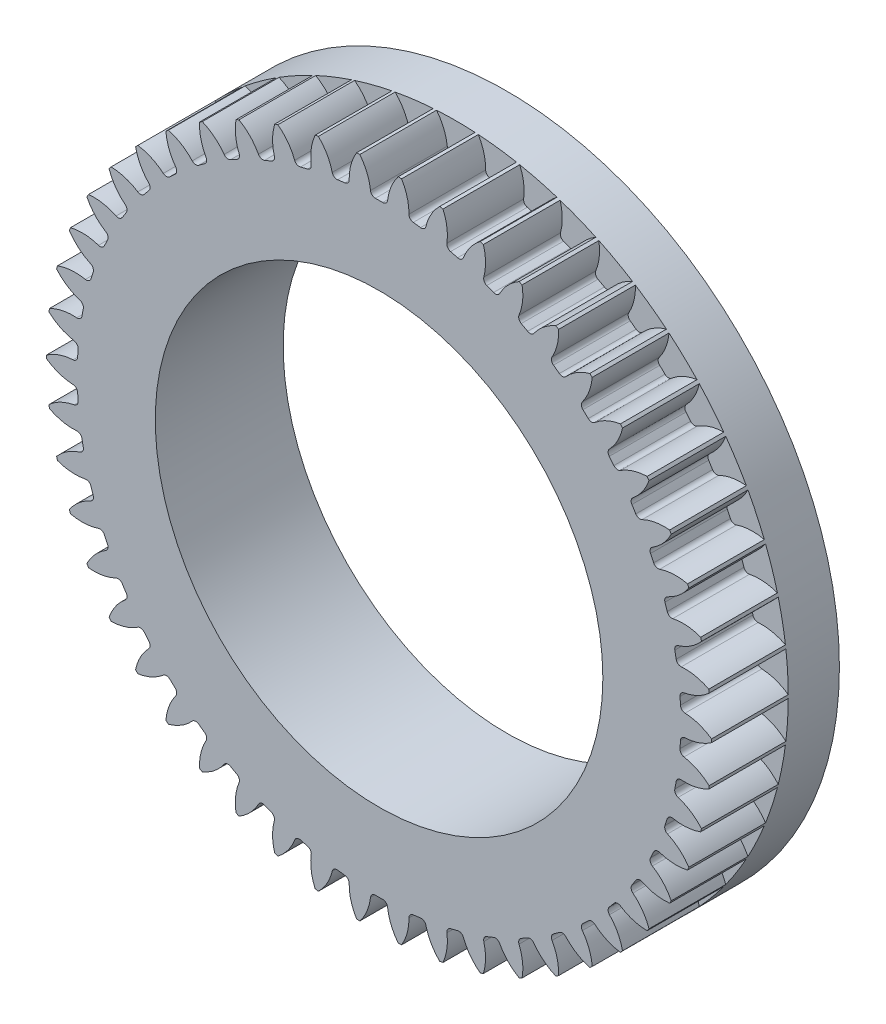
from build123d import *

# Parameters (mm, degrees)
SKETCH1_R                = 26
SKETCH1_R_2              = 17.5
BOSS_EXTRUDE1_DEPTH      = 10
CUT_EXTRUDE3_START       = -10
CUT_EXTRUDE3_DEPTH       = 49.105117767
FILLET1_R                = 0.38
CIRPATTERN1_COUNT        = 50
FILLET1_OF_CIRPATTERN1_R = 0.38
SKETCH1_8_R              = 26
SKETCH1_8_R_2            = 17.5
CUT_EXTRUDE4_DEPTH       = 4
SKETCH1_9_R              = 26
SKETCH1_9_R_2            = 17.5
BOSS_EXTRUDE2_DEPTH      = 4


with BuildPart() as part:
    # Sketch1 → Boss-Extrude1 (new body)
    with BuildSketch(Plane.XY):
        Circle(SKETCH1_R)
        Circle(SKETCH1_R_2, mode=Mode.SUBTRACT)
    extrude(amount=BOSS_EXTRUDE1_DEPTH)

    # Sketch2 → Cut-Extrude3 (cut)
    with BuildSketch(Plane.XY.offset(10).offset(CUT_EXTRUDE3_START)):
        with BuildLine():
            Line((80.813454696, 125.882981301), (1.504086556, 25.956458226))
            ThreePointArc((1.504086556, 25.956458226), (0.881704537, 24.843708327), (0.643214976, 23.591233001))
            ThreePointArc((0.643214976, 23.591233001), (0, 23.6), (-0.643214976, 23.591233001))
            ThreePointArc((-0.643214976, 23.591233001), (-0.881704537, 24.843708327), (-1.504086556, 25.956458226))
            Line((-1.504086556, 25.956458226), (-80.813454696, 125.882981301))
            Line((-80.813454696, 125.882981301), (-80.813454696, 381.032238707))
            Line((-80.813454696, 381.032238707), (80.813454696, 381.032238707))
            Line((80.813454696, 381.032238707), (80.813454696, 125.882981301))
        make_face()
    cut_extrude3 = extrude(amount=CUT_EXTRUDE3_DEPTH, mode=Mode.SUBTRACT)

    # Fillet1
    fillet1_edges = [part.edges().sort_by_distance(p)[0] for p in [
        (0.643214976, 23.591233001, 5),
        (-0.643214976, 23.591233001, 5),
    ]]
    fillet(fillet1_edges, radius=FILLET1_R)

    # CirPattern1: Cut-Extrude3 ×50 about axis
    cirpattern1_axis = Axis((0, 0, 10), (0, 0, 1))
    for i in range(1, CIRPATTERN1_COUNT):
        add(cut_extrude3.rotate(cirpattern1_axis, i * 360 / CIRPATTERN1_COUNT), mode=Mode.SUBTRACT)

    # Fillet1 of CirPattern1
    fillet1_of_cirpattern1_edges = [part.edges().sort_by_distance(p)[0] for p in [
        (-2.318622481, 23.485825295, 5),
        (-3.59490855, 23.324592869, 5),
        (-5.243893878, 23.010032095, 5),
        (-6.489908268, 22.690109975, 5),
        (-8.086465935, 22.171356943, 5),
        (-9.282558256, 21.697790492, 5),
        (-10.801509594, 20.983026247, 5),
        (-11.928816755, 20.363283891, 5),
        (-13.346206994, 19.463780693, 5),
        (-14.386950688, 18.707636139, 5),
        (-15.680426737, 17.63757969, 5),
        (-16.618193814, 16.756957789, 5),
        (-17.767356784, 15.53322352, 5),
        (-18.587358097, 14.542012205, 5),
        (-19.574085, 13.183899135, 5),
        (-20.263388639, 12.097730402, 5),
        (-21.072118203, 10.626656785, 5),
        (-21.619853437, 9.462660163, 5),
        (-22.237831514, 7.90182571, 5),
        (-22.635360232, 6.678358121, 5),
        (-23.052840938, 5.052378123, 5),
        (-23.293893873, 3.788734382, 5),
        (-23.504293289, 2.123251515, 5),
        (-23.585068894, 0.839360038, 5),
        (-23.585068894, -0.839360038, 5),
        (-23.504293289, -2.123251515, 5),
        (-23.293893873, -3.788734382, 5),
        (-23.052840938, -5.052378123, 5),
        (-22.635360232, -6.678358121, 5),
        (-22.237831514, -7.90182571, 5),
        (-21.619853437, -9.462660163, 5),
        (-21.072118203, -10.626656785, 5),
        (-20.263388639, -12.097730402, 5),
        (-19.574085, -13.183899135, 5),
        (-18.587358097, -14.542012205, 5),
        (-17.767356784, -15.53322352, 5),
        (-16.618193814, -16.756957789, 5),
        (-15.680426737, -17.63757969, 5),
        (-14.386950688, -18.707636139, 5),
        (-13.346206994, -19.463780693, 5),
        (-11.928816755, -20.363283891, 5),
        (-10.801509594, -20.983026247, 5),
        (-9.282558256, -21.697790492, 5),
        (-8.086465935, -22.171356943, 5),
        (-6.489908268, -22.690109975, 5),
        (-5.243893878, -23.010032095, 5),
        (-3.59490855, -23.324592869, 5),
        (-2.318622481, -23.485825295, 5),
        (-0.643214976, -23.591233001, 5),
        (0.643214976, -23.591233001, 5),
        (2.318622481, -23.485825295, 5),
        (3.59490855, -23.324592869, 5),
        (5.243893878, -23.010032095, 5),
        (6.489908268, -22.690109975, 5),
        (8.086465935, -22.171356943, 5),
        (9.282558256, -21.697790492, 5),
        (10.801509594, -20.983026247, 5),
        (11.928816755, -20.363283891, 5),
        (13.346206994, -19.463780693, 5),
        (14.386950688, -18.707636139, 5),
        (15.680426737, -17.63757969, 5),
        (16.618193814, -16.756957789, 5),
        (17.767356784, -15.53322352, 5),
        (18.587358097, -14.542012205, 5),
        (19.574085, -13.183899135, 5),
        (20.263388639, -12.097730402, 5),
        (21.072118203, -10.626656785, 5),
        (21.619853437, -9.462660163, 5),
        (22.237831514, -7.90182571, 5),
        (22.635360232, -6.678358121, 5),
        (23.052840938, -5.052378123, 5),
        (23.293893873, -3.788734382, 5),
        (23.504293289, -2.123251515, 5),
        (23.585068894, -0.839360038, 5),
        (23.585068894, 0.839360038, 5),
        (23.504293289, 2.123251515, 5),
        (23.293893873, 3.788734382, 5),
        (23.052840938, 5.052378123, 5),
        (22.635360232, 6.678358121, 5),
        (22.237831514, 7.90182571, 5),
        (21.619853437, 9.462660163, 5),
        (21.072118203, 10.626656785, 5),
        (20.263388639, 12.097730402, 5),
        (19.574085, 13.183899135, 5),
        (18.587358097, 14.542012205, 5),
        (17.767356784, 15.53322352, 5),
        (16.618193814, 16.756957789, 5),
        (15.680426737, 17.63757969, 5),
        (14.386950688, 18.707636139, 5),
        (13.346206994, 19.463780693, 5),
        (11.928816755, 20.363283891, 5),
        (10.801509594, 20.983026247, 5),
        (9.282558256, 21.697790492, 5),
        (8.086465935, 22.171356943, 5),
        (6.489908268, 22.690109975, 5),
        (5.243893878, 23.010032095, 5),
        (3.59490855, 23.324592869, 5),
        (2.318622481, 23.485825295, 5),
    ]]
    fillet(fillet1_of_cirpattern1_edges, radius=FILLET1_OF_CIRPATTERN1_R)

    # Sketch1<8> → Cut-Extrude4 (cut)
    with BuildSketch(Plane.XY):
        Circle(SKETCH1_8_R)
        Circle(SKETCH1_8_R_2, mode=Mode.SUBTRACT)
    extrude(amount=CUT_EXTRUDE4_DEPTH, mode=Mode.SUBTRACT)

    # Sketch1<9> → Boss-Extrude2 (add)
    with BuildSketch(Plane.XY):
        Circle(SKETCH1_9_R)
        Circle(SKETCH1_9_R_2, mode=Mode.SUBTRACT)
    extrude(amount=BOSS_EXTRUDE2_DEPTH)


solid = part.part
